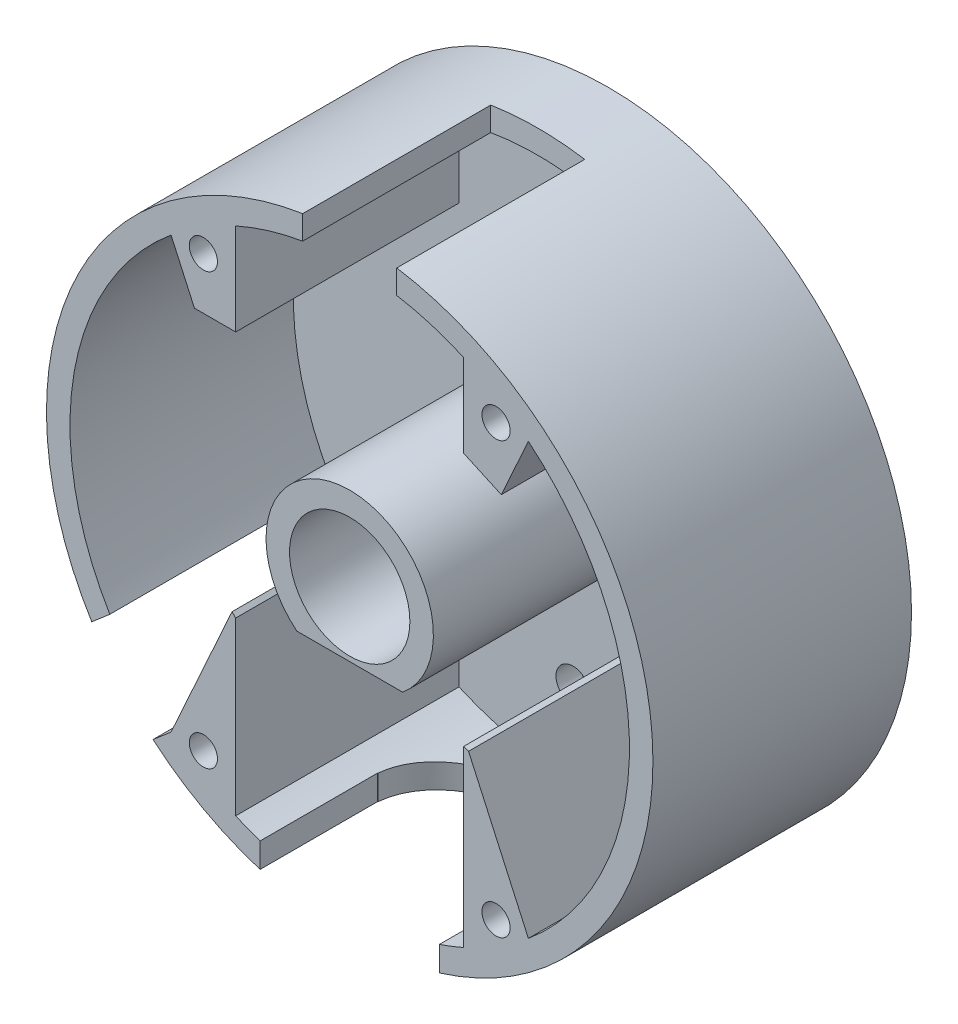
from build123d import *
from OCP.BRepFilletAPI import BRepFilletAPI_MakeChamfer

# Parameters (mm, degrees)
SKETCH_1_R               = 5
EXTRUDE_1_DEPTH          = 2
EXTRUDE_2_DEPTH          = 20
EXTRUDE_2_DEPTH_BACK     = 2
SKETCH_2_R               = 25.8
SKETCH_2_R_2             = 23.8
SKETCH_3_R               = 1.45
CUT_EXTRUDE_2_DEPTH      = 2
SKETCH_4_R               = 23.8
SKETCH_4_R_2             = 1.45
EXTRUDE_3_DEPTH          = 1
SKETCH_5_R               = 3.05
SKETCH_5_R_2             = 1.45
CUT_EXTRUDE_3_DEPTH      = 1
CUT_EXTRUDE_5_REACH      = 62.647
CUT_EXTRUDE_5_END_RADIUS = 25.8
SKETCH_6_R               = 7.625
CUT_EXTRUDE_START        = -16
CUT_EXTRUDE_6_DEPTH      = 16
EXTRUDE_5_DEPTH          = 19
CHAMFER_1_SIZE           = 1
CHAMFER_1_SIZE2          = 0.755634891
SKETCH_9_R               = 5.12
EXTRUDE_6_DEPTH          = 19
EXTRUDE_START            = -19
SKETCH_11_R              = 1.2
EXTRUDE_7_DEPTH          = 19
CHAMFER_3_SIZE           = 7.761762605
CHAMFER_3_SIZE_2         = 10
SKETCH_13_R              = 1.2
CUT_EXTRUDE_7_DEPTH      = 19
CUT_EXTRUDE_START_2      = -10
CUT_EXTRUDE_8_DEPTH      = 10
SKETCH_15_R              = 5.12
CUT_EXTRUDE_9_DEPTH      = 10


with BuildPart() as part:
    # 草图1 → 凸台-拉伸1 (new body)
    with BuildSketch(Plane.XY):
        with BuildLine():
            ThreePointArc((64, 25.8), (38.2, 0), (64, -25.8))
            ThreePointArc((64, -25.8), (82.243354955, -18.243354955), (89.8, 0))
            ThreePointArc((89.8, 0), (82.243354955, 18.243354955), (64, 25.8))
        make_face()
        with Locations((64, 0)):
            Circle(SKETCH_1_R, mode=Mode.SUBTRACT)
    extrude(amount=EXTRUDE_1_DEPTH)

    # 草图2 → 凸台-拉伸2 (add, two sides: drawn at the far end of the back side and taken through both)
    with BuildSketch(Plane.XY.offset(2).offset(-EXTRUDE_2_DEPTH_BACK)):
        with Locations((64, 0)):
            Circle(SKETCH_2_R)
        with Locations((64, 0)):
            Circle(SKETCH_2_R_2, mode=Mode.SUBTRACT)
    extrude(amount=EXTRUDE_2_DEPTH + EXTRUDE_2_DEPTH_BACK)

    # 草图3 → 切除-拉伸2 (cut)
    with BuildSketch(Plane.XY.offset(2)):
        with Locations((64, -16.8)):
            Circle(SKETCH_3_R)
    extrude(amount=-CUT_EXTRUDE_2_DEPTH, mode=Mode.SUBTRACT)

    # 草图4 → 凸台-拉伸3 (add)
    with BuildSketch(Plane.XY.offset(2)):
        with Locations((64, 0)):
            Circle(SKETCH_4_R)
        with Locations((64, -16.8)):
            Circle(SKETCH_4_R_2, mode=Mode.SUBTRACT)
    extrude(amount=EXTRUDE_3_DEPTH)

    # 草图5 → 切除-拉伸3 (cut)
    with BuildSketch(Plane(origin=(0, 0, 0), x_dir=(-1, 0, 0), z_dir=(0, 0, -1))):
        with Locations((-64, -16.8)):
            Circle(SKETCH_5_R)
        with Locations(Location((-64, -16.8, 0), (0, 0, 180))):
            Circle(SKETCH_5_R_2, mode=Mode.SUBTRACT)
    extrude(amount=-CUT_EXTRUDE_3_DEPTH, mode=Mode.SUBTRACT)

    # 切除-拉伸5: up to this cylinder (the profile starts inside it)
    cut_extrude_5_end = Plane(origin=(64, 0, 12.5), z_dir=(0, 0, -1)) * Cylinder(CUT_EXTRUDE_5_END_RADIUS, 177.894, mode=Mode.PRIVATE)
    # 草图6 → 切除-拉伸5 (cut, up to the surface)
    with BuildSketch(Plane(origin=(74.5, -5.45, -15.2), x_dir=(0, 0, -1), z_dir=(0, 1, 0)), mode=Mode.PRIVATE) as cut_extrude_5_sk1:
        with Locations(Location((-27.7, 10.5, 0), (0, 0, 90))):
            Circle(SKETCH_6_R)
    cut_extrude_5_tool1 = extrude(cut_extrude_5_sk1.sketch, amount=-CUT_EXTRUDE_5_REACH, mode=Mode.PRIVATE) & cut_extrude_5_end
    add(cut_extrude_5_tool1.solids().sort_by_distance((64, -5.45, 12.5))[0], mode=Mode.SUBTRACT)

    # 草图7 → 切除-拉伸6 (cut)
    with BuildSketch(Plane.XY.offset(22).offset(CUT_EXTRUDE_START)):
        with BuildLine():
            ThreePointArc((48.798857294, -18.312980654), (47.30860295, -16.965767431), (45.937273528, -15.497674419))
            Line((45.937273528, -15.497674419), (44.419397354, -16.8))
            ThreePointArc((44.419397354, -16.8), (45.784957677, -18.271623715), (47.260809567, -19.632613266))
            Line((47.260809567, -19.632613266), (48.798857294, -18.312980654))
        make_face()
        with BuildLine():
            Line((44.419397354, -16.8), (45.937273528, -15.497674419))
            ThreePointArc((45.937273528, -15.497674419), (44.694639643, -13.919161667), (43.589554969, -12.241475957))
            Line((43.589554969, -12.241475957), (42.051507242, -13.561108569))
            ThreePointArc((42.051507242, -13.561108569), (43.172397024, -15.22665276), (44.419397354, -16.8))
        make_face()
        with BuildLine():
            Line((64, 25.8), (64, 23.8))
            ThreePointArc((64, 23.8), (66.007150396, 23.715213414), (68, 23.461457755))
            Line((68, 23.461457755), (68, 25.488036409))
            ThreePointArc((68, 25.488036409), (66.006073359, 25.721890865), (64, 25.8))
        make_face()
        with BuildLine():
            ThreePointArc((60, 23.461457755), (61.992849604, 23.715213414), (64, 23.8))
            Line((64, 23.8), (64, 25.8))
            ThreePointArc((64, 25.8), (61.993926641, 25.721890865), (60, 25.488036409))
            Line((60, 25.488036409), (60, 23.461457755))
        make_face()
    extrude(amount=CUT_EXTRUDE_6_DEPTH, mode=Mode.SUBTRACT)

    # 草图8 → 凸台-拉伸5 (add)
    with BuildSketch(Plane.XY.offset(3)):
        with BuildLine():
            Line((73.7, -20.16), (73.7, -21.733614518))
            ThreePointArc((73.7, -21.733614518), (76.567494222, -20.211335655), (79.201142706, -18.312980654))
            Line((79.201142706, -18.312980654), (73.7, -6.16))
            Line((73.7, -6.16), (73.7, -20.16))
        make_face()
        with BuildLine():
            Line((54.3, -20.16), (54.3, -6.16))
            Line((54.3, -6.16), (48.798857294, -18.312980654))
            ThreePointArc((48.798857294, -18.312980654), (51.432505778, -20.211335655), (54.3, -21.733614518))
            Line((54.3, -21.733614518), (54.3, -20.16))
        make_face()
    extrude(amount=EXTRUDE_5_DEPTH)

    # 倒角1: one chamfer whose edges measure the first distance from different faces: ONE call of the kernel's chamfer builder (chamfer() names one face for all edges)
    chamfer_1_edges_1 = [part.edges().sort_by_distance(p)[0] for p in [
        (73.7, -6.16, 12.5),
    ]]
    chamfer_1_side_1 = [part.faces().sort_by_distance(p)[0] for p in [
        (76.450571353, -12.236490327, 12.5),
    ]]
    chamfer_1_edges_2 = [part.edges().sort_by_distance(p)[0] for p in [
        (54.3, -6.16, 12.5),
    ]]
    chamfer_1_side_2 = [part.faces().sort_by_distance(p)[0] for p in [
        (54.3, -13.946807259, 12.5),
    ]]
    chamfer_1 = BRepFilletAPI_MakeChamfer(part.part.solid().wrapped)
    for e in chamfer_1_edges_1:
        chamfer_1.Add(CHAMFER_1_SIZE, CHAMFER_1_SIZE2, e.wrapped, chamfer_1_side_1[0].wrapped)  # the first distance lies on this face
    for e in chamfer_1_edges_2:
        chamfer_1.Add(CHAMFER_1_SIZE, CHAMFER_1_SIZE2, e.wrapped, chamfer_1_side_2[0].wrapped)  # the first distance lies on this face
    add(Compound.cast(chamfer_1.Shape()), mode=Mode.REPLACE)

    # 草图9 → 凸台-拉伸6 (add)
    with BuildSketch(Plane.XY.offset(3)):
        with BuildLine():
            ThreePointArc((71.12, 0), (60.944269687, 6.430934011), (59.502889817, -5.52))
            Line((59.502889817, -5.52), (64, -5.52))
            Line((64, -5.52), (68.497110183, -5.52))
            ThreePointArc((68.497110183, -5.52), (70.430934011, -3.055730313), (71.12, 0))
        make_face()
        with Locations((64, 0)):
            Circle(SKETCH_9_R, mode=Mode.SUBTRACT)
    extrude(amount=EXTRUDE_6_DEPTH)

    # 草图11 → 凸台-拉伸7 (add)
    # profile 1 of 2: a face of its own
    with BuildSketch(Plane.XY.offset(22).offset(EXTRUDE_START)):
        with BuildLine():
            Line((74.1123773, 7.071013151), (79.201142706, 18.312980654))
            ThreePointArc((79.201142706, 18.312980654), (76.567494222, 20.211335655), (73.7, 21.733614518))
            Line((73.7, 21.733614518), (73.7, 6.915634891))
            Line((73.7, 6.915634891), (74.1123773, 7.071013151))
        make_face()
        with Locations((76.450571353, 18.312980654)):
            Circle(SKETCH_11_R, mode=Mode.SUBTRACT)
    # profile 2 of 2: a face of its own
    with BuildSketch(Plane.XY.offset(22).offset(EXTRUDE_START)):
        with BuildLine():
            ThreePointArc((54.3, 21.733614518), (51.432505778, 20.211335655), (48.798857294, 18.312980654))
            Line((48.798857294, 18.312980654), (53.988393324, 6.848393324))
            Line((53.988393324, 6.848393324), (54.3, 7.16))
            Line((54.3, 7.16), (54.3, 21.733614518))
        make_face()
        with Locations((51.549428647, 18.312980654)):
            Circle(SKETCH_11_R, mode=Mode.SUBTRACT)
    extrude(amount=EXTRUDE_7_DEPTH)

    # 倒角3
    # the kernel refuses this chamfer: 10, 7.761762605 mm, written as the material it takes off along each edge
    with BuildSketch(Plane(origin=(53.988393324, 6.848393324, 3), x_dir=(-0.45377895497770065, 0.8911142799996788, 0), z_dir=(0, 0, 1)), Plane(origin=(73.7, 6.915634891, 3), x_dir=(-0.045923294763777815, 0.9989449689537653, 0), z_dir=(0, 0, 1))) as chamfer_3_piece_1:
        Polygon((CHAMFER_3_SIZE * 0.998944968965, -CHAMFER_3_SIZE * 0.0459232947643), (CHAMFER_3_SIZE_2 * 0.309242773975, -CHAMFER_3_SIZE_2 * 0.950983126424), (0, 0), align=None)
    extrude(amount=44.71682988, mode=Mode.SUBTRACT)

    # 草图13 → 切除-拉伸7 (cut)
    with BuildSketch(Plane.XY.offset(22)):
        with Locations((76.450571353, -18.312980654)):
            Circle(SKETCH_13_R)
        with Locations((51.549428647, -18.312980654)):
            Circle(SKETCH_13_R)
    extrude(amount=-CUT_EXTRUDE_7_DEPTH, mode=Mode.SUBTRACT)

    # 草图14 → 切除-拉伸8 (cut)
    with BuildSketch(Plane.XY.offset(22).offset(CUT_EXTRUDE_START_2)):
        with BuildLine():
            Line((56.375, -22.54549567), (56.375, -24.647502409))
            ThreePointArc((56.375, -24.647502409), (64, -25.8), (71.625, -24.647502409))
            Line((71.625, -24.647502409), (71.625, -22.54549567))
            ThreePointArc((71.625, -22.54549567), (64, -23.8), (56.375, -22.54549567))
        make_face()
    extrude(amount=CUT_EXTRUDE_8_DEPTH, mode=Mode.SUBTRACT)

    # 草图15 → 切除-拉伸9 (cut)
    with BuildSketch(Plane.XY.offset(3).offset(CUT_EXTRUDE_START_2)):
        with Locations((64, 0)):
            Circle(SKETCH_15_R)
    extrude(amount=CUT_EXTRUDE_9_DEPTH, mode=Mode.SUBTRACT)


solid = part.part
